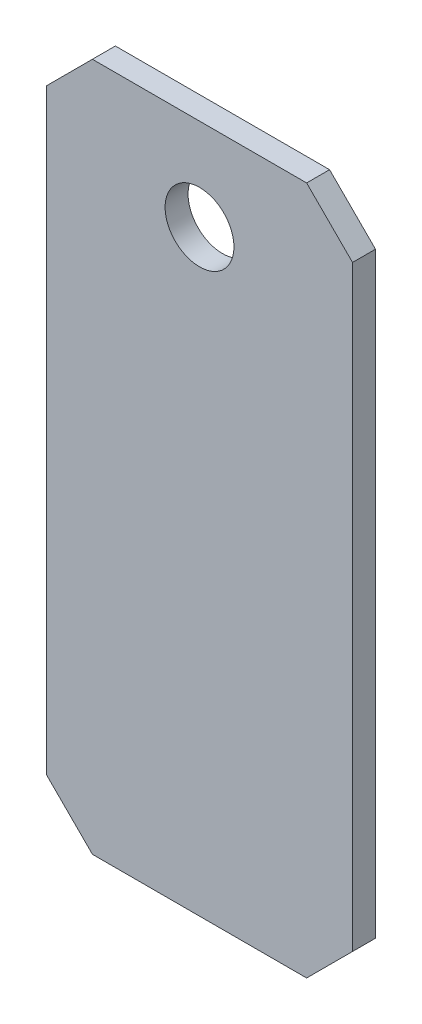
from build123d import *

# Parameters (mm, degrees)
SKETCH1_R  = 2.25
BASE_DEPTH = 0.75


with BuildPart() as part:
    # Sketch1 → Base (new, symmetric)
    with BuildSketch(Plane.XY):
        Polygon((-7, 22.5), (-10, 19.5), (-10, -19.5), (-7, -22.5), (7, -22.5), (10, -19.5), (10, 19.5), (7, 22.5), align=None)
        with Locations((0, 16.5)):
            Circle(SKETCH1_R, mode=Mode.SUBTRACT)
    extrude(amount=BASE_DEPTH, both=True)


solid = part.part
